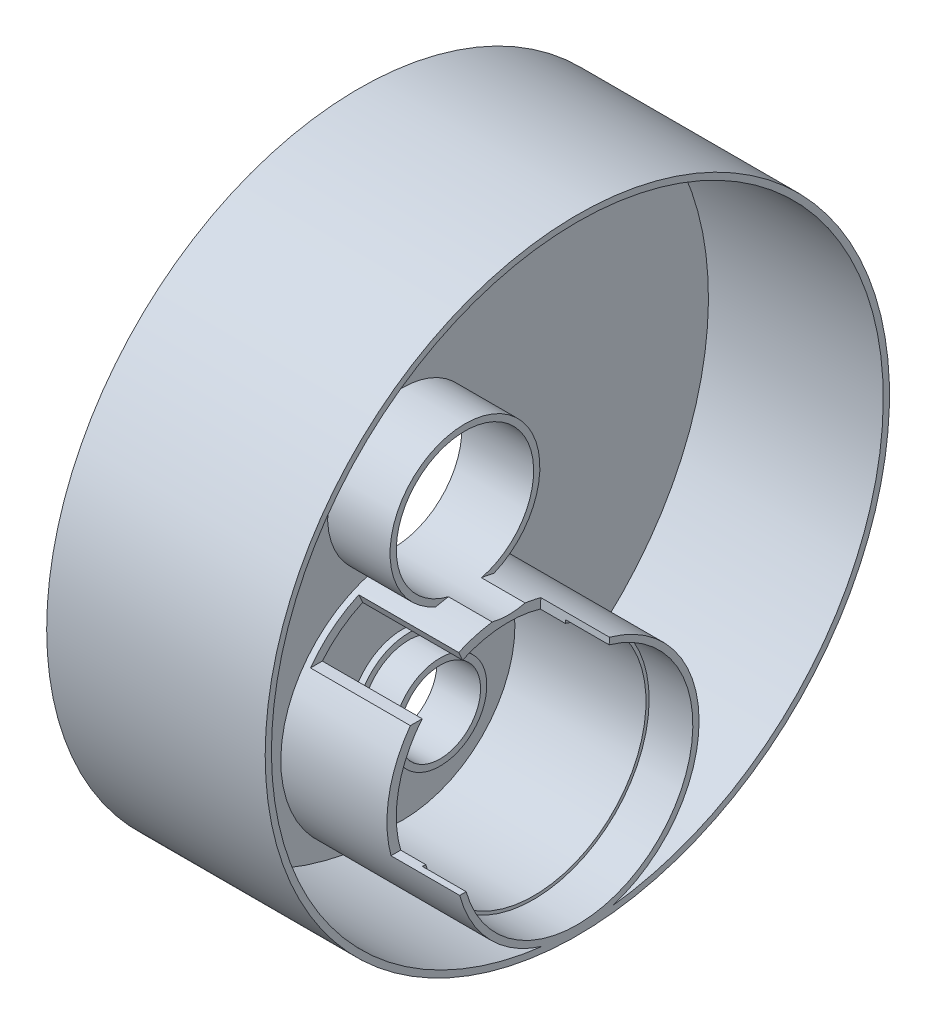
from build123d import *

# Parameters (mm, degrees)
CUT_EXTRUDE_START        = -11
CUT_EXTRUDE_1_DEPTH      = 11
CUT_EXTRUDE_2_DEPTH      = 27
EXTRUDE_START            = -1
SKETCH_4_R               = 50
SKETCH_4_R_2             = 6.5
EXTRUDE_1_DEPTH          = 1
EXTRUDE_2_DEPTH          = 6
EXTRUDE_2_DEPTH_BACK     = 29
SKETCH_5_R               = 50
SKETCH_5_R_2             = 49
EXTRUDE_3_DEPTH          = 1.5
EXTRUDE_3_DEPTH_BACK     = 10
SKETCH_15_R              = 12
SKETCH_15_R_2            = 11
CUT_EXTRUDE_4_DEPTH      = 99.407316801
CUT_EXTRUDE_4_DEPTH_BACK = 99.407316801
SKETCH_16_R              = 11
CUT_EXTRUDE_3_REACH      = 100.697
SKETCH_12_R              = 5
M2X0_41_D                = 1.6
PATTERN_CIRCULAR_1_COUNT = 3


with BuildPart() as part:
    # Эскиз1 → Повернуть1 (revolve)
    with BuildSketch(Plane.XY):
        Polygon((-27, 7.5), (-27, 8.5), (-28, 8.5), (-28, 18), (-7, 18), (-7, 18.5), (0, 18.5), (0, 19.5), (-29, 19.5), (-29, 6.5), (-22, 6.5), (-22, 7.5), align=None)
    revolve(axis=Axis((0, 0, 0), (1, 0, 0)))

    # Эскиз2 → Вырез-Вытянуть1 (cut)
    with BuildSketch(Plane(origin=(0, 0, 0), x_dir=(0, 0, -1), z_dir=(1, 0, 0)).offset(CUT_EXTRUDE_START)):
        with BuildLine():
            Line((5.156251293, 18.805931846), (5, 16.248076809))
            ThreePointArc((5, 16.248076809), (-12.02081528, 12.02081528), (-16.248076809, -5))
            Line((-16.248076809, -5), (-18.848076825, -5))
            ThreePointArc((-18.848076825, -5), (-13.731246096, 13.845680938), (5.156251293, 18.805931846))
        make_face()
    extrude(amount=CUT_EXTRUDE_1_DEPTH, mode=Mode.SUBTRACT)

    # Эскиз3 → Вырез-Вытянуть2 (cut)
    with BuildSketch(Plane(origin=(0, 0, 0), x_dir=(0, 0, -1), z_dir=(1, 0, 0))):
        with BuildLine():
            Line((-40, 11.5), (-12.519984026, 11.5))
            ThreePointArc((-12.519984026, 11.5), (-9.954045186, 13.781037132), (-6.982120022, 15.5))
            Line((-6.982120022, 15.5), (-13.240816858, 29.394032278))
            Line((-13.240816858, 29.394032278), (-40, 11.5))
        make_face()
    extrude(amount=-CUT_EXTRUDE_2_DEPTH, mode=Mode.SUBTRACT)

    # Эскиз4 → Бобышка-Вытянуть1 (add)
    with BuildSketch(Plane.ZY.offset(29).offset(EXTRUDE_START)):
        with Locations((0, 30)):
            Circle(SKETCH_4_R)
        Circle(SKETCH_4_R_2, mode=Mode.SUBTRACT)
    extrude(amount=EXTRUDE_1_DEPTH)

    # Эскиз5 → Бобышка-Вытянуть2 (add, two sides: drawn at the far end of the back side and taken through both)
    with BuildSketch(Plane.ZY.offset(29).offset(-EXTRUDE_2_DEPTH_BACK)):
        with Locations((0, 30)):
            Circle(SKETCH_5_R)
        with Locations((0, 30)):
            Circle(SKETCH_5_R_2, mode=Mode.SUBTRACT)
    extrude(amount=EXTRUDE_2_DEPTH + EXTRUDE_2_DEPTH_BACK)

    # Эскиз15 → Бобышка-Вытянуть3 (add, two sides: drawn at the far end of the back side and taken through both)
    with BuildSketch(Plane.ZY.offset(28).offset(-EXTRUDE_3_DEPTH_BACK)):
        with Locations((0, 30)):
            Circle(SKETCH_15_R)
        with Locations((0, 30)):
            Circle(SKETCH_15_R_2, mode=Mode.SUBTRACT)
    extrude(amount=EXTRUDE_3_DEPTH + EXTRUDE_3_DEPTH_BACK)

    # Эскиз16 → Вырез-Вытянуть4 (cut, two sides: drawn at the far end of the back side and taken through both)
    with BuildSketch(Plane(origin=(-28, 0, 0), x_dir=(0, 0, -1), z_dir=(1, 0, 0)).offset(-CUT_EXTRUDE_4_DEPTH_BACK)):
        with Locations((0, 30)):
            Circle(SKETCH_16_R)
    extrude(amount=CUT_EXTRUDE_4_DEPTH + CUT_EXTRUDE_4_DEPTH_BACK, mode=Mode.SUBTRACT)

    # Эскиз12 → Вырез-Вытянуть3 (cut, up to next)
    with BuildSketch(Plane.ZY.offset(29), mode=Mode.PRIVATE) as cut_extrude_3_sk1:
        with Locations((0, 56.4)):
            Circle(SKETCH_12_R)
    cut_extrude_3_tool1 = extrude(cut_extrude_3_sk1.sketch, amount=-CUT_EXTRUDE_3_REACH, mode=Mode.PRIVATE) & part.part
    add(cut_extrude_3_tool1.solids().sort_by_distance((-29, 56.4, 0))[0], mode=Mode.SUBTRACT)

    # Сверление под метчик M2x0.41 (through all)
    with Locations(Plane.ZY.offset(29)):
        with Locations((0, 62.9)):
            m2x0_41 = Hole(M2X0_41_D / 2)

    # Круговой массив1: Сверление под метчик M2x0.41 ×3 about axis
    pattern_circular_1_axis = Axis((0.001, 56.4, 0), (-1, 0, 0))
    for i in range(1, PATTERN_CIRCULAR_1_COUNT):
        add(m2x0_41.rotate(pattern_circular_1_axis, i * 360 / PATTERN_CIRCULAR_1_COUNT), mode=Mode.SUBTRACT)


solid = part.part
